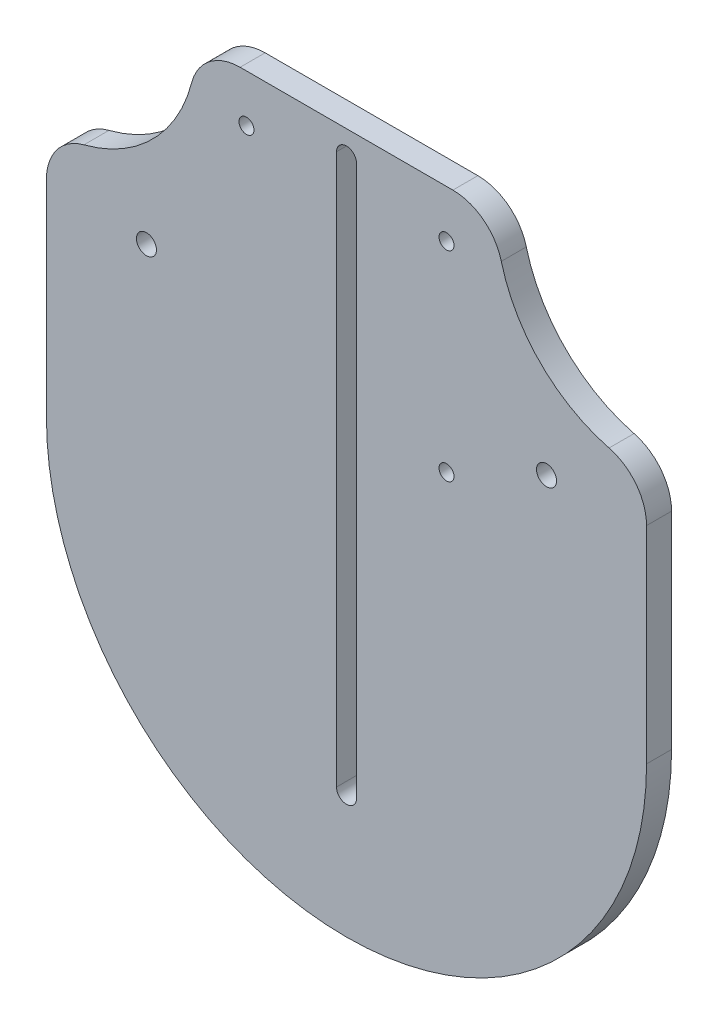
from build123d import *

# Parameters (mm, degrees)
CROQUIS1_W              = 120
CROQUIS1_H              = 140
SALIENTE_EXTRUIR1_DEPTH = 5
CROQUIS2_R              = 2
CROQUIS2_R_2            = 1.5
CORTAR_EXTRUIR1_DEPTH   = 5
CROQUIS3_W              = 4
CROQUIS3_H              = 110.000000561
CORTAR_EXTRUIR2_DEPTH   = 5
CROQUIS5_R              = 30
CORTAR_EXTRUIR3_DEPTH   = 5
REDONDEO2_R             = 10
REDONDEO3_R             = 60


with BuildPart() as part:
    # Croquis1 → Saliente-Extruir1 (new body)
    with BuildSketch(Plane.XY):
        Rectangle(CROQUIS1_W, CROQUIS1_H)
    extrude(amount=SALIENTE_EXTRUIR1_DEPTH)

    # Croquis2 → Cortar-Extruir1 (cut)
    with BuildSketch(Plane.XY.offset(5)):
        with Locations((-40, 30)):
            Circle(CROQUIS2_R)
        with Locations((40, 30)):
            Circle(CROQUIS2_R)
        with Locations((0, 65)):
            Circle(CROQUIS2_R)
        with Locations((0, -45)):
            Circle(CROQUIS2_R)
        with Locations((-20, 60.5)):
            Circle(CROQUIS2_R_2)
        with Locations((20, 60.5)):
            Circle(CROQUIS2_R_2)
        with Locations((20, 20.5)):
            Circle(CROQUIS2_R_2)
    extrude(amount=-CORTAR_EXTRUIR1_DEPTH, mode=Mode.SUBTRACT)

    # Croquis3 → Cortar-Extruir2 (cut)
    with BuildSketch(Plane.XY.offset(5)):
        with Locations((0, 9.999999746)):
            Rectangle(CROQUIS3_W, CROQUIS3_H)
    extrude(amount=-CORTAR_EXTRUIR2_DEPTH, mode=Mode.SUBTRACT)

    # Croquis5 → Cortar-Extruir3 (cut)
    with BuildSketch(Plane.XY.offset(5)):
        with Locations((-60, 70)):
            Circle(CROQUIS5_R)
        with Locations((60, 70)):
            Circle(CROQUIS5_R)
    extrude(amount=-CORTAR_EXTRUIR3_DEPTH, mode=Mode.SUBTRACT)

    # Redondeo2
    redondeo2_edges = [part.edges().sort_by_distance(p)[0] for p in [
        (-30, 70, 2.5),
        (-60, 40, 2.5),
        (60, 40, 2.5),
        (30, 70, 2.5),
    ]]
    fillet(redondeo2_edges, radius=REDONDEO2_R)

    # Redondeo3
    redondeo3_edges = [part.edges().sort_by_distance(p)[0] for p in [
        (60, -70, 2.5),
        (-60, -70, 2.5),
    ]]
    fillet(redondeo3_edges, radius=REDONDEO3_R - 0.0001)  # a hair under: the kernel refuses the full size


solid = part.part
